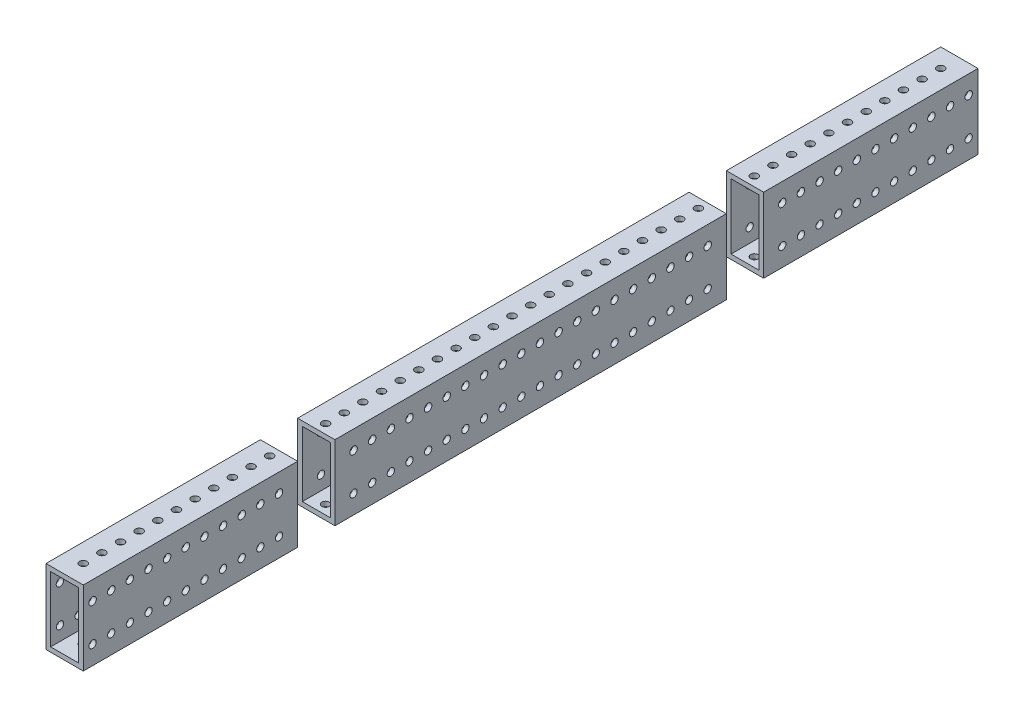
from build123d import *

# Parameters (mm, degrees)
SKETCH1_W           = 25.4
SKETCH1_H           = 50.8
SKETCH1_W_2         = 19.05
SKETCH1_H_2         = 44.45
BOSS_EXTRUDE1_DEPTH = 304.8
SKETCH2_R           = 2.5527
CUT_EXTRUDE1_DEPTH  = 310.265209812
SKETCH4_R           = 2.4892
SKETCH4_R_2         = 2.5527
CUT_EXTRUDE3_DEPTH  = 307.909367729
SKETCH6_W           = 25.4
SKETCH6_H           = 50.8
CUT_EXTRUDE4_DEPTH  = 307.909367729


with BuildPart() as part:
    # Sketch1 → Boss-Extrude1 (new, symmetric)
    with BuildSketch(Plane.XY):
        Rectangle(SKETCH1_W, SKETCH1_H)
        Rectangle(SKETCH1_W_2, SKETCH1_H_2, mode=Mode.SUBTRACT)
    extrude(amount=BOSS_EXTRUDE1_DEPTH, both=True)

    # Sketch2 → Cut-Extrude1 (cut, through all)
    with BuildSketch(Plane(origin=(0, 25.4, 0), x_dir=(1, 0, 0), z_dir=(0, 1, 0))):
        with Locations((0, -292.1)):
            Circle(SKETCH2_R)
        with Locations((0, -279.4)):
            Circle(SKETCH2_R)
        with Locations((0, -266.7)):
            Circle(SKETCH2_R)
        with Locations((0, -254)):
            Circle(SKETCH2_R)
        with Locations((0, -241.3)):
            Circle(SKETCH2_R)
        with Locations((0, -228.6)):
            Circle(SKETCH2_R)
        with Locations((0, -215.9)):
            Circle(SKETCH2_R)
        with Locations((0, -203.2)):
            Circle(SKETCH2_R)
        with Locations((0, -190.5)):
            Circle(SKETCH2_R)
        with Locations((0, -177.8)):
            Circle(SKETCH2_R)
        with Locations((0, -165.1)):
            Circle(SKETCH2_R)
        with Locations((0, -152.4)):
            Circle(SKETCH2_R)
        with Locations((0, -139.7)):
            Circle(SKETCH2_R)
        with Locations((0, -127)):
            Circle(SKETCH2_R)
        with Locations((0, -114.3)):
            Circle(SKETCH2_R)
        with Locations((0, -101.6)):
            Circle(SKETCH2_R)
        with Locations((0, -88.9)):
            Circle(SKETCH2_R)
        with Locations((0, -76.2)):
            Circle(SKETCH2_R)
        with Locations((0, -63.5)):
            Circle(SKETCH2_R)
        with Locations((0, -50.8)):
            Circle(SKETCH2_R)
        with Locations((0, -38.1)):
            Circle(SKETCH2_R)
        with Locations((0, -25.4)):
            Circle(SKETCH2_R)
        with Locations((0, -12.7)):
            Circle(SKETCH2_R)
        Circle(SKETCH2_R)
        with Locations((0, 12.7)):
            Circle(SKETCH2_R)
        with Locations((0, 25.4)):
            Circle(SKETCH2_R)
        with Locations((0, 38.1)):
            Circle(SKETCH2_R)
        with Locations((0, 50.8)):
            Circle(SKETCH2_R)
        with Locations((0, 63.5)):
            Circle(SKETCH2_R)
        with Locations((0, 76.2)):
            Circle(SKETCH2_R)
        with Locations((0, 88.9)):
            Circle(SKETCH2_R)
        with Locations((0, 101.6)):
            Circle(SKETCH2_R)
        with Locations((0, 114.3)):
            Circle(SKETCH2_R)
        with Locations((0, 127)):
            Circle(SKETCH2_R)
        with Locations((0, 139.7)):
            Circle(SKETCH2_R)
        with Locations((0, 152.4)):
            Circle(SKETCH2_R)
        with Locations((0, 165.1)):
            Circle(SKETCH2_R)
        with Locations((0, 177.8)):
            Circle(SKETCH2_R)
        with Locations((0, 190.5)):
            Circle(SKETCH2_R)
        with Locations((0, 203.2)):
            Circle(SKETCH2_R)
        with Locations((0, 215.9)):
            Circle(SKETCH2_R)
        with Locations((0, 228.6)):
            Circle(SKETCH2_R)
        with Locations((0, 241.3)):
            Circle(SKETCH2_R)
        with Locations((0, 254)):
            Circle(SKETCH2_R)
        with Locations((0, 266.7)):
            Circle(SKETCH2_R)
        with Locations((0, 279.4)):
            Circle(SKETCH2_R)
        with Locations((0, 292.1)):
            Circle(SKETCH2_R)
    extrude(amount=-CUT_EXTRUDE1_DEPTH, mode=Mode.SUBTRACT)

    # Sketch4 → Cut-Extrude3 (cut, through all)
    with BuildSketch(Plane(origin=(12.7, 0, 0), x_dir=(0, 0, -1), z_dir=(1, 0, 0))):
        with Locations((-298.45, -12.7)):
            Circle(SKETCH4_R)
        with Locations((-285.75, -12.7)):
            Circle(SKETCH4_R)
        with Locations((-273.05, -12.7)):
            Circle(SKETCH4_R)
        with Locations((-260.35, -12.7)):
            Circle(SKETCH4_R)
        with Locations((-247.65, -12.7)):
            Circle(SKETCH4_R)
        with Locations((146.05, -12.7)):
            Circle(SKETCH4_R)
        with Locations((171.45, -12.7)):
            Circle(SKETCH4_R)
        with Locations((184.15, -12.7)):
            Circle(SKETCH4_R)
        with Locations((196.85, -12.7)):
            Circle(SKETCH4_R)
        with Locations((209.55, -12.7)):
            Circle(SKETCH4_R)
        with Locations((222.25, -12.7)):
            Circle(SKETCH4_R)
        with Locations((234.95, -12.7)):
            Circle(SKETCH4_R)
        with Locations((247.65, -12.7)):
            Circle(SKETCH4_R)
        with Locations((260.35, -12.7)):
            Circle(SKETCH4_R)
        with Locations((273.05, -12.7)):
            Circle(SKETCH4_R)
        with Locations((285.75, -12.7)):
            Circle(SKETCH4_R)
        with Locations((298.45, -12.7)):
            Circle(SKETCH4_R)
        with Locations((-298.45, 12.7)):
            Circle(SKETCH4_R_2)
        with Locations((-285.75, 12.7)):
            Circle(SKETCH4_R_2)
        with Locations((-234.95, -12.7)):
            Circle(SKETCH4_R)
        with Locations((-222.25, -12.7)):
            Circle(SKETCH4_R)
        with Locations((-209.55, -12.7)):
            Circle(SKETCH4_R)
        with Locations((-196.85, -12.7)):
            Circle(SKETCH4_R)
        with Locations((-184.15, -12.7)):
            Circle(SKETCH4_R)
        with Locations((-171.45, -12.7)):
            Circle(SKETCH4_R)
        with Locations((-146.05, -12.7)):
            Circle(SKETCH4_R)
        with Locations((-120.65, -12.7)):
            Circle(SKETCH4_R)
        with Locations((-107.95, -12.7)):
            Circle(SKETCH4_R)
        with Locations((-95.25, -12.7)):
            Circle(SKETCH4_R)
        with Locations((-82.55, -12.7)):
            Circle(SKETCH4_R)
        with Locations((-69.85, -12.7)):
            Circle(SKETCH4_R)
        with Locations((-57.15, -12.7)):
            Circle(SKETCH4_R)
        with Locations((-44.45, -12.7)):
            Circle(SKETCH4_R)
        with Locations((-31.75, -12.7)):
            Circle(SKETCH4_R)
        with Locations((-19.05, -12.7)):
            Circle(SKETCH4_R)
        with Locations((-6.35, -12.7)):
            Circle(SKETCH4_R)
        with Locations((6.35, -12.7)):
            Circle(SKETCH4_R)
        with Locations((19.05, -12.7)):
            Circle(SKETCH4_R)
        with Locations((31.75, -12.7)):
            Circle(SKETCH4_R)
        with Locations((44.45, -12.7)):
            Circle(SKETCH4_R)
        with Locations((57.15, -12.7)):
            Circle(SKETCH4_R)
        with Locations((69.85, -12.7)):
            Circle(SKETCH4_R)
        with Locations((82.55, -12.7)):
            Circle(SKETCH4_R)
        with Locations((95.25, -12.7)):
            Circle(SKETCH4_R)
        with Locations((107.95, -12.7)):
            Circle(SKETCH4_R)
        with Locations((120.65, -12.7)):
            Circle(SKETCH4_R)
        with Locations((-273.05, 12.7)):
            Circle(SKETCH4_R_2)
        with Locations((-260.35, 12.7)):
            Circle(SKETCH4_R_2)
        with Locations((-247.65, 12.7)):
            Circle(SKETCH4_R_2)
        with Locations((-234.95, 12.7)):
            Circle(SKETCH4_R_2)
        with Locations((-222.25, 12.7)):
            Circle(SKETCH4_R_2)
        with Locations((-209.55, 12.7)):
            Circle(SKETCH4_R_2)
        with Locations((-196.85, 12.7)):
            Circle(SKETCH4_R_2)
        with Locations((-184.15, 12.7)):
            Circle(SKETCH4_R_2)
        with Locations((-171.45, 12.7)):
            Circle(SKETCH4_R_2)
        with Locations((-146.05, 12.7)):
            Circle(SKETCH4_R_2)
        with Locations((-120.65, 12.7)):
            Circle(SKETCH4_R_2)
        with Locations((-107.95, 12.7)):
            Circle(SKETCH4_R_2)
        with Locations((-95.25, 12.7)):
            Circle(SKETCH4_R_2)
        with Locations((-82.55, 12.7)):
            Circle(SKETCH4_R_2)
        with Locations((-69.85, 12.7)):
            Circle(SKETCH4_R_2)
        with Locations((-57.15, 12.7)):
            Circle(SKETCH4_R_2)
        with Locations((-44.45, 12.7)):
            Circle(SKETCH4_R_2)
        with Locations((-31.75, 12.7)):
            Circle(SKETCH4_R_2)
        with Locations((-19.05, 12.7)):
            Circle(SKETCH4_R_2)
        with Locations((-6.35, 12.7)):
            Circle(SKETCH4_R_2)
        with Locations((6.35, 12.7)):
            Circle(SKETCH4_R_2)
        with Locations((19.05, 12.7)):
            Circle(SKETCH4_R_2)
        with Locations((31.75, 12.7)):
            Circle(SKETCH4_R_2)
        with Locations((44.45, 12.7)):
            Circle(SKETCH4_R_2)
        with Locations((57.15, 12.7)):
            Circle(SKETCH4_R_2)
        with Locations((69.85, 12.7)):
            Circle(SKETCH4_R_2)
        with Locations((82.55, 12.7)):
            Circle(SKETCH4_R_2)
        with Locations((95.25, 12.7)):
            Circle(SKETCH4_R_2)
        with Locations((107.95, 12.7)):
            Circle(SKETCH4_R_2)
        with Locations((120.65, 12.7)):
            Circle(SKETCH4_R_2)
        with Locations((146.05, 12.7)):
            Circle(SKETCH4_R_2)
        with Locations((171.45, 12.7)):
            Circle(SKETCH4_R_2)
        with Locations((184.15, 12.7)):
            Circle(SKETCH4_R_2)
        with Locations((196.85, 12.7)):
            Circle(SKETCH4_R_2)
        with Locations((209.55, 12.7)):
            Circle(SKETCH4_R_2)
        with Locations((222.25, 12.7)):
            Circle(SKETCH4_R_2)
        with Locations((234.95, 12.7)):
            Circle(SKETCH4_R_2)
        with Locations((247.65, 12.7)):
            Circle(SKETCH4_R_2)
        with Locations((260.35, 12.7)):
            Circle(SKETCH4_R_2)
        with Locations((273.05, 12.7)):
            Circle(SKETCH4_R_2)
        with Locations((285.75, 12.7)):
            Circle(SKETCH4_R_2)
        with Locations((298.45, 12.7)):
            Circle(SKETCH4_R_2)
    extrude(amount=-CUT_EXTRUDE3_DEPTH, mode=Mode.SUBTRACT)

    # Sketch6 → Cut-Extrude4 (cut, through all)
    with BuildSketch(Plane.ZY.offset(12.7)):
        with Locations((-146.05, 0)):
            Rectangle(SKETCH6_W, SKETCH6_H)
        with Locations((146.05, 0)):
            Rectangle(SKETCH6_W, SKETCH6_H)
    extrude(amount=-CUT_EXTRUDE4_DEPTH, mode=Mode.SUBTRACT)


with BuildPart() as cut_extrude4_piece_1:
    # of the separate pieces the step leaves, piece 1, a body of its own (cut_extrude4_pieces)
    add(part.part.solids().sort_by_distance((-12.7, 25.4, -133.35))[0])


with BuildPart() as cut_extrude4_piece_2:
    # of the separate pieces the step leaves, piece 2, a body of its own (cut_extrude4_pieces)
    add(part.part.solids().sort_by_distance((-12.7, 25.4, -304.8))[0])


with BuildPart() as cut_extrude4_piece_3:
    # of the separate pieces the step leaves, piece 3, a body of its own (cut_extrude4_pieces)
    add(part.part.solids().sort_by_distance((-12.7, 25.4, 158.75))[0])


solid = Compound([cut_extrude4_piece_1.part, cut_extrude4_piece_2.part, cut_extrude4_piece_3.part])
